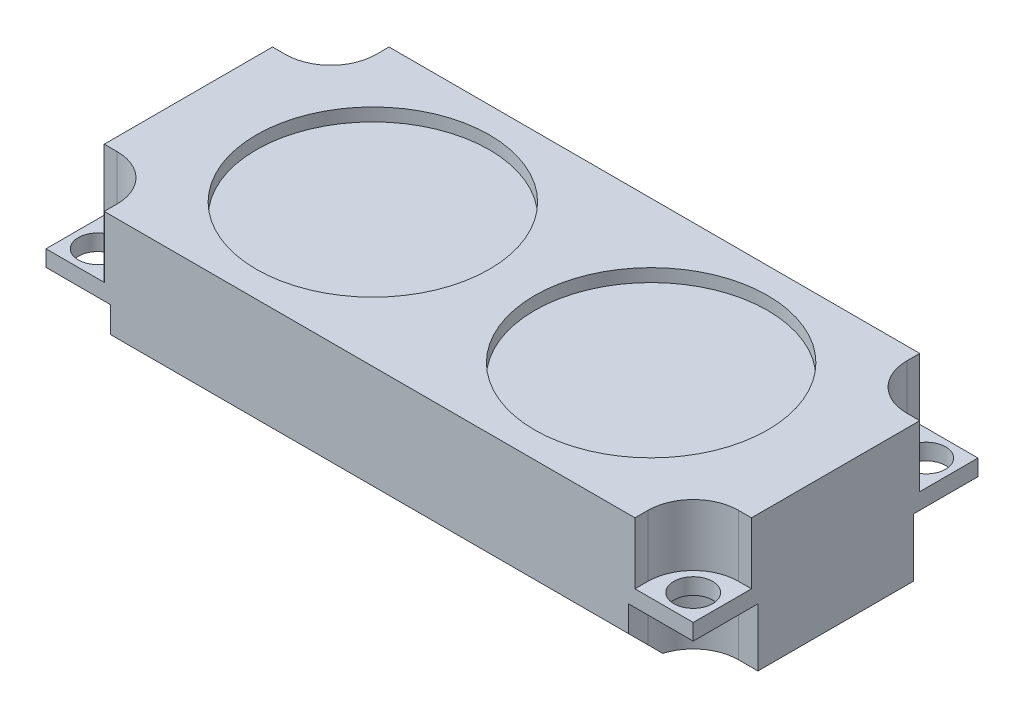
from build123d import *

# Parameters (mm, degrees)
SKETCH_1_W          = 100
SKETCH_1_H          = 44
EXTRUDE_1_DEPTH     = 21
CHAMFER_1_SIZE      = 5
SKETCH_2_R          = 3
CUT_EXTRUDE_1_DEPTH = 112.251966275
SKETCH_3_W          = 9
SKETCH_3_H          = 9
CUT_EXTRUDE_2_DEPTH = 9.5
SKETCH_4_R          = 18
CUT_EXTRUDE_3_DEPTH = 2
SKETCH_5_W          = 10
SKETCH_5_H          = 10
CUT_EXTRUDE_4_DEPTH = 9
FILLET_1_R          = 7


with BuildPart() as part:
    # 草图1 → 凸台-拉伸1 (new body)
    with BuildSketch(Plane(origin=(0, 0, 0), x_dir=(1, 0, 0), z_dir=(0, 1, 0))):
        with Locations((50, 22)):
            Rectangle(SKETCH_1_W, SKETCH_1_H)
    extrude(amount=EXTRUDE_1_DEPTH)

    # 倒角1
    chamfer_1_edges = [part.edges().sort_by_distance(p)[0] for p in [
        (50, 0, -44),
        (50, 0, 0),
    ]]
    chamfer(chamfer_1_edges, length=CHAMFER_1_SIZE)

    # 草图2 → 切除-拉伸1 (cut, through all)
    with BuildSketch(Plane(origin=(0, 21, 0), x_dir=(1, 0, 0), z_dir=(0, 1, 0))):
        with Locations(Location((96, 4, 0), (0, 0, 270))):
            Circle(SKETCH_2_R)
        with Locations(Location((4, 4, 0), (0, 0, 160.528779366))):
            Circle(SKETCH_2_R)
        with Locations(Location((4, 40, 0), (0, 0, 270))):
            Circle(SKETCH_2_R)
        with Locations(Location((96, 40, 0), (0, 0, 199.471220634))):
            Circle(SKETCH_2_R)
    extrude(amount=-CUT_EXTRUDE_1_DEPTH, mode=Mode.SUBTRACT)

    # 草图3 → 切除-拉伸2 (cut)
    with BuildSketch(Plane(origin=(0, 21, 0), x_dir=(1, 0, 0), z_dir=(0, 1, 0))):
        with Locations((95.5, 4.5)):
            Rectangle(SKETCH_3_W, SKETCH_3_H)
        with Locations((4.5, 4.5)):
            Rectangle(SKETCH_3_W, SKETCH_3_H)
        with Locations((95.5, 39.5)):
            Rectangle(SKETCH_3_W, SKETCH_3_H)
        with Locations((4.5, 39.5)):
            Rectangle(SKETCH_3_W, SKETCH_3_H)
    extrude(amount=-CUT_EXTRUDE_2_DEPTH, mode=Mode.SUBTRACT)

    # 草图4 → 切除-拉伸3 (cut)
    with BuildSketch(Plane(origin=(0, 21, 0), x_dir=(1, 0, 0), z_dir=(0, 1, 0))):
        with Locations(Location((28.5, 22, 0), (0, 0, 270))):
            Circle(SKETCH_4_R)
        with Locations(Location((71.5, 22, 0), (0, 0, 90))):
            Circle(SKETCH_4_R)
    extrude(amount=-CUT_EXTRUDE_3_DEPTH, mode=Mode.SUBTRACT)

    # 草图5 → 切除-拉伸4 (cut)
    with BuildSketch(Plane.XZ):
        with Locations((95, -39)):
            Rectangle(SKETCH_5_W, SKETCH_5_H)
        with Locations((95, -5)):
            Rectangle(SKETCH_5_W, SKETCH_5_H)
        with Locations((5, -5)):
            Rectangle(SKETCH_5_W, SKETCH_5_H)
        with Locations((5, -39)):
            Rectangle(SKETCH_5_W, SKETCH_5_H)
    extrude(amount=-CUT_EXTRUDE_4_DEPTH, mode=Mode.SUBTRACT)

    # 圆角1
    # the kernel refuses this fillet: 7 mm, written as the material it adds along each edge
    with BuildSketch(Plane(origin=(9, 21, -35), x_dir=(-1, 0, 0), z_dir=(0, -1, 0))) as fillet_1_piece_1:
        with BuildLine():
            CenterArc((FILLET_1_R, FILLET_1_R), FILLET_1_R, 180, 90)
            Line((0, FILLET_1_R), (0, 0))
            Line((0, 0), (FILLET_1_R, 0))
        make_face()
    extrude(amount=9.5)
    with BuildSketch(Plane(origin=(9, 21, -9), x_dir=(0, 0, 1), z_dir=(0, -1, 0))) as fillet_1_piece_2_section:
        with BuildLine():
            CenterArc((FILLET_1_R, FILLET_1_R), FILLET_1_R, 180, 90)
            Line((0, FILLET_1_R), (0, 0))
            Line((0, 0), (FILLET_1_R, 0))
        make_face()
    fillet_1_piece_2 = extrude(amount=27, mode=Mode.PRIVATE)
    fillet_1_piece_2 = split(fillet_1_piece_2, bisect_by=Plane(origin=(7.436424427, 9, -7.436424427), z_dir=(0, 1, 0)), keep=Keep.TOP, mode=Mode.PRIVATE)
    add(fillet_1_piece_2)
    with BuildSketch(Plane(origin=(10, 0, -10), x_dir=(0, 0, 1), z_dir=(0, 1, 0))) as fillet_1_piece_3_section:
        with BuildLine():
            CenterArc((FILLET_1_R, -FILLET_1_R), FILLET_1_R, 90, 90)
            Line((0, -FILLET_1_R), (0, 0))
            Line((0, 0), (FILLET_1_R, 0))
        make_face()
    fillet_1_piece_3 = extrude(amount=26.5, mode=Mode.PRIVATE)
    fillet_1_piece_3 = split(fillet_1_piece_3, bisect_by=Plane(origin=(9.565673238, 1.191688147, -3.808311853), z_dir=(0, 0.7071067811865476, -0.7071067811865476)), keep=Keep.TOP, mode=Mode.PRIVATE)
    fillet_1_piece_3 = split(fillet_1_piece_3, bisect_by=Plane(origin=(9.565673238, 21, -7.128953399), z_dir=(0, -1, 0)), keep=Keep.TOP, mode=Mode.PRIVATE)
    add(fillet_1_piece_3)
    with BuildSketch(Plane(origin=(10, 0, -34), x_dir=(-1, 0, 0), z_dir=(0, 1, 0))) as fillet_1_piece_4_section:
        with BuildLine():
            CenterArc((FILLET_1_R, -FILLET_1_R), FILLET_1_R, 90, 90)
            Line((0, -FILLET_1_R), (0, 0))
            Line((0, 0), (FILLET_1_R, 0))
        make_face()
    fillet_1_piece_4 = extrude(amount=26.5, mode=Mode.PRIVATE)
    fillet_1_piece_4 = split(fillet_1_piece_4, bisect_by=Plane(origin=(7.120179523, 21, -34.433198562), z_dir=(0, -1, 0)), keep=Keep.TOP, mode=Mode.PRIVATE)
    fillet_1_piece_4 = split(fillet_1_piece_4, bisect_by=Plane(origin=(7.120179523, -0.033400719, -38.966599281), z_dir=(0, 0.7071067811865476, 0.7071067811865476)), keep=Keep.TOP, mode=Mode.PRIVATE)
    add(fillet_1_piece_4)
    with BuildSketch(Plane(origin=(91, 21, -35), x_dir=(1, 0, 0), z_dir=(0, -1, 0)), Plane(origin=(91, 21, -9), x_dir=(0, 0, 1), z_dir=(0, -1, 0))) as fillet_1_piece_5:
        with BuildLine():
            CenterArc((FILLET_1_R, -FILLET_1_R), FILLET_1_R, 90, 90)
            Line((0, -FILLET_1_R), (0, 0))
            Line((0, 0), (FILLET_1_R, 0))
        make_face()
    extrude(amount=9.5)
    with BuildSketch(Plane(origin=(90, 0, -34), x_dir=(1, 0, 0), z_dir=(0, 1, 0))) as fillet_1_piece_6_section:
        with BuildLine():
            CenterArc((FILLET_1_R, FILLET_1_R), FILLET_1_R, 180, 90)
            Line((0, FILLET_1_R), (0, 0))
            Line((0, 0), (FILLET_1_R, 0))
        make_face()
    fillet_1_piece_6 = extrude(amount=26.5, mode=Mode.PRIVATE)
    fillet_1_piece_6 = split(fillet_1_piece_6, bisect_by=Plane(origin=(92.879820477, 21, -34.433198562), z_dir=(0, -1, 0)), keep=Keep.TOP, mode=Mode.PRIVATE)
    fillet_1_piece_6 = split(fillet_1_piece_6, bisect_by=Plane(origin=(92.879820477, -0.033400719, -38.966599281), z_dir=(0, 0.7071067811865476, 0.7071067811865476)), keep=Keep.TOP, mode=Mode.PRIVATE)
    add(fillet_1_piece_6)
    with BuildSketch(Plane(origin=(90, 0, -10), x_dir=(0, 0, 1), z_dir=(0, 1, 0))) as fillet_1_piece_7_section:
        with BuildLine():
            CenterArc((FILLET_1_R, FILLET_1_R), FILLET_1_R, 180, 90)
            Line((0, FILLET_1_R), (0, 0))
            Line((0, 0), (FILLET_1_R, 0))
        make_face()
    fillet_1_piece_7 = extrude(amount=26.5, mode=Mode.PRIVATE)
    fillet_1_piece_7 = split(fillet_1_piece_7, bisect_by=Plane(origin=(90.434326762, 1.191688147, -3.808311853), z_dir=(0, 0.7071067811865476, -0.7071067811865476)), keep=Keep.TOP, mode=Mode.PRIVATE)
    fillet_1_piece_7 = split(fillet_1_piece_7, bisect_by=Plane(origin=(90.434326762, 21, -7.128953399), z_dir=(0, -1, 0)), keep=Keep.TOP, mode=Mode.PRIVATE)
    add(fillet_1_piece_7)


solid = part.part
